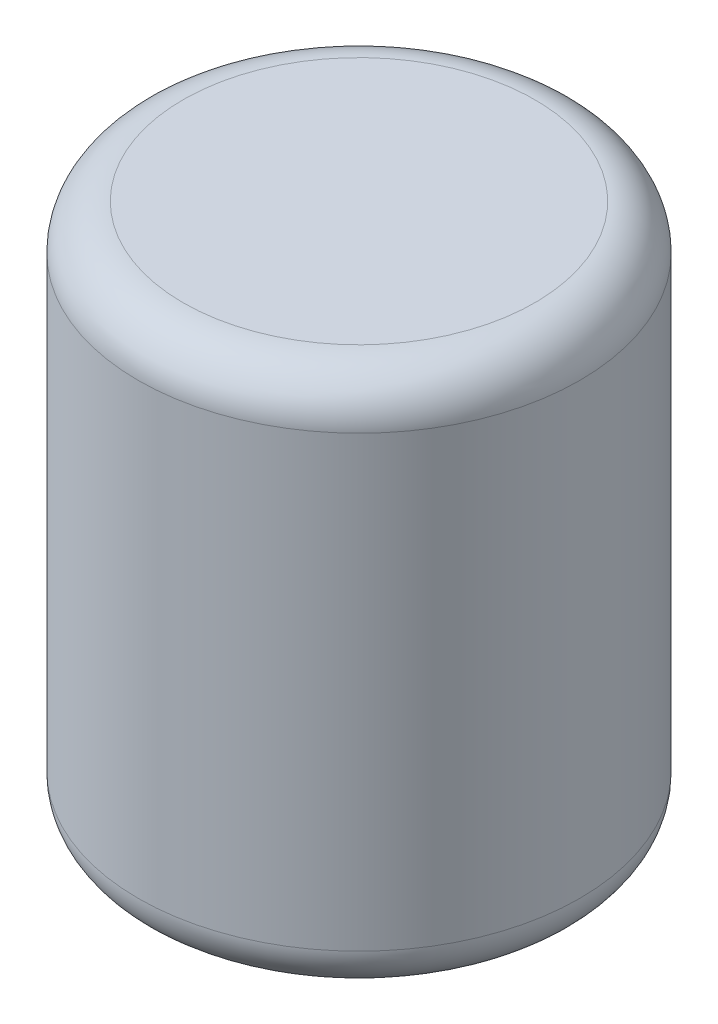
from build123d import *

# Parameters (mm, degrees)
FILLET1_R = 0.5


with BuildPart() as part:
    # Sketch1 → Revolve1 (revolve)
    with BuildSketch(Plane.XY, mode=Mode.PRIVATE) as revolve1_sk:
        Polygon((-1.4605, 0), (-1.4605, 4), (0, 4), (0, 6), (-2.4605, 6), (-2.4605, 0), align=None)
    revolve(revolve1_sk.sketch.rotate(Axis((0, 0, 0), (0, -1, 0)), 270), axis=Axis((0, 0, 0), (0, -1, 0)))

    # Fillet1
    fillet1_edges = [part.edges().sort_by_distance(p)[0] for p in [
        (0, 0, -2.4605),
        (0, 6, -2.4605),
        (0, 0, -1.4605),
    ]]
    fillet(fillet1_edges, radius=FILLET1_R - 0.0001)  # a hair under: the kernel refuses the full size


solid = part.part
